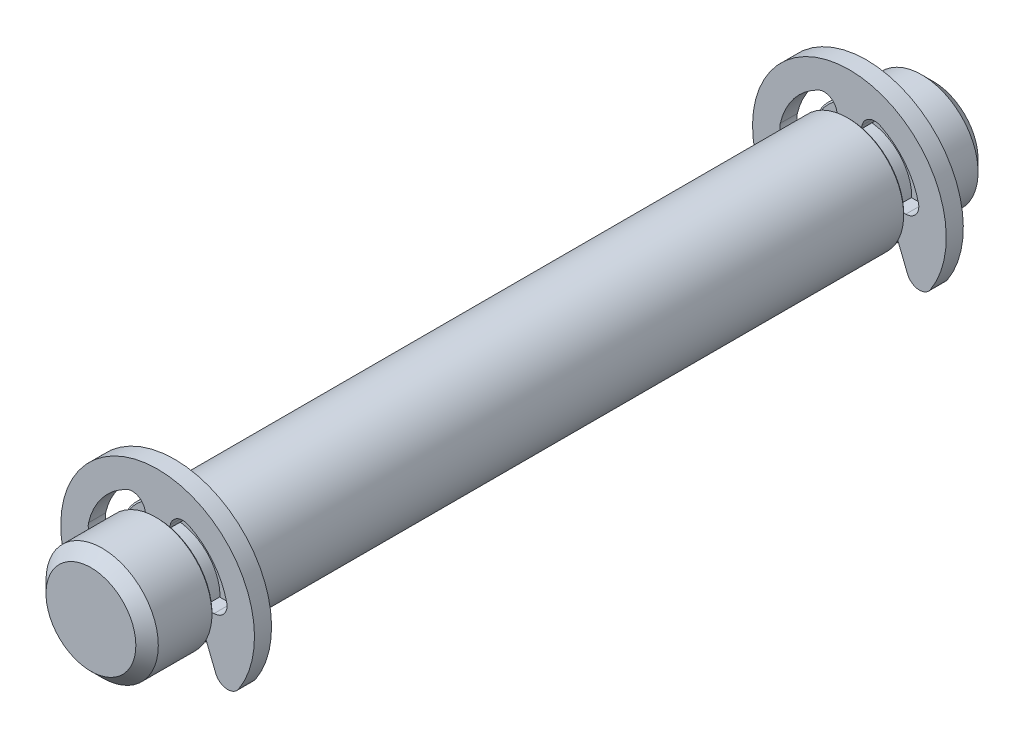
from build123d import *

# Parameters (mm, degrees)
CHAMFER1_SIZE       = 0.4
BOSS_EXTRUDE2_DEPTH = 0.304
FILLET1_R           = 0.4625
CHAMFER2_SIZE       = 0.05


with BuildPart() as part:
    # Sketch1 → Revolve1 (revolve)
    with BuildSketch(Plane(origin=(0, 0, 0), x_dir=(1, 0, 0), z_dir=(0, 1, 0))):
        Polygon((-2, 12), (-1.6, 12), (-1.6, 12.64), (-2, 12.64), (-2, 15), (0, 15), (0, -15), (-2, -15), (-2, -12.64), (-1.6, -12.64), (-1.6, -12), (-2, -12), align=None)
    revolve(axis=Axis((0, 0, -15), (0, 0, 1)))

    # Chamfer1
    chamfer1_edges = [part.edges().sort_by_distance(p)[0] for p in [
        (2, 0, 15),
        (2, 0, -15),
    ]]
    chamfer(chamfer1_edges, length=CHAMFER1_SIZE)

    # Chamfer2
    chamfer2_edges = [part.edges().sort_by_distance(p)[0] for p in [
        (2, 0, -12.64),
        (2, 0, -12),
        (2, 0, 12),
        (2, 0, 12.64),
    ]]
    chamfer(chamfer2_edges, length=CHAMFER2_SIZE)


with BuildPart() as body_2:
    # Sketch2 → Boss-Extrude2 (new, symmetric)
    with BuildSketch(Plane.XY.offset(12.32)):
        with BuildLine():
            Line((-2.350930667, -2.525), (-1.531696364, -0.4625))
            ThreePointArc((-1.531696364, -0.4625), (-1.582831984, -0.233758228), (-1.6, 0))
            Line((-1.6, 0), (-2.525, 0))
            ThreePointArc((-2.525, 0), (-1.975513934, 1.572567867), (-0.566212121, 2.460696819))
            Line((-0.566212121, 2.460696819), (-0.450721695, 1.958787879))
            ThreePointArc((-0.450721695, 1.958787879), (0, 1.6), (0.450721695, 1.958787879))
            Line((0.450721695, 1.958787879), (0.566212121, 2.460696819))
            ThreePointArc((0.566212121, 2.460696819), (1.975513934, 1.572567867), (2.525, 0))
            Line((2.525, 0), (1.6, 0))
            ThreePointArc((1.6, 0), (1.582831984, -0.233758228), (1.531696364, -0.4625))
            Line((1.531696364, -0.4625), (2.350930667, -2.525))
            ThreePointArc((2.350930667, -2.525), (0, 3.45), (-2.350930667, -2.525))
        make_face()
    extrude(amount=BOSS_EXTRUDE2_DEPTH, both=True)

    # Fillet1
    fillet1_edges = [body_2.edges().sort_by_distance(p)[0] for p in [
        (2.525, 0, 12.32),
        (-0.566212121, 2.460696819, 12.32),
        (-2.525, 0, 12.32),
        (0.566212121, 2.460696819, 12.32),
        (2.350930667, -2.525, 12.32),
        (-2.350930667, -2.525, 12.32),
    ]]
    fillet(fillet1_edges, radius=FILLET1_R - 0.0001)  # a hair under: the kernel refuses the full size


with BuildPart() as body_3:
    # Mirror1: mirrored copy
    add(body_2.part.mirror(Plane.XY))


solid = Compound([part.part, body_2.part, body_3.part])
